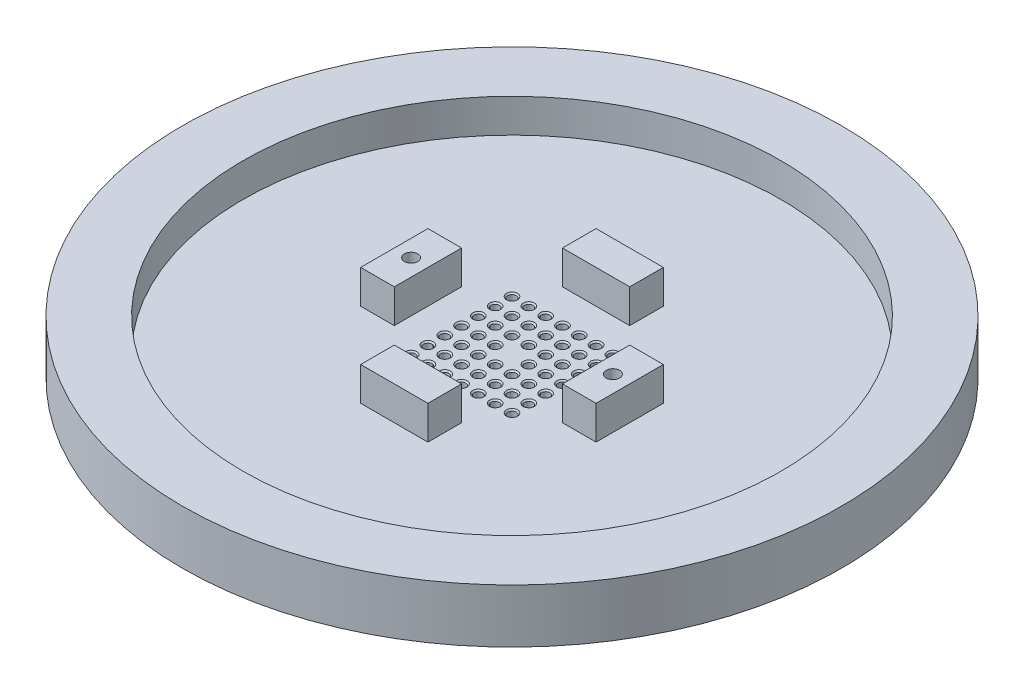
from build123d import *

# Parameters (mm, degrees)
SKETCH1_R                                     = 62.23
BILLET_DEPTH                                  = 10.16
SKETCH2_R                                     = 50.8
MANIFOLD_WELL_DEPTH                           = 6.35
SKETCH4_R                                     = 0.79375
FIRST_KEROSENE_OUTLET_DEPTH                   = 89.591034535
OUTLET_CHAMFER_SIZE                           = 0.254
KEROSENE_OUTLET_PATTERN_COUNT                 = 7
KEROSENE_OUTLET_PATTERN_PITCH                 = 3.175
KEROSENE_OUTLET_PATTERN_COUNT_DIR2            = 7
KEROSENE_OUTLET_PATTERN_PITCH_DIR2            = 3.175
OUTLET_CHAMFER_OF_KEROSENE_OUTLET_PATTER_SIZE = 0.254
LOX_PLATE_STANDOFF_REACH                      = 90.591
SKETCH5_W                                     = 12.7
SKETCH5_H                                     = 6.35
STANDOFF_PATTERN_COUNT                        = 4
SKETCH7_R                                     = 59.69
SKETCH7_R_2                                   = 57.15
O_RING_GROOVE_DEPTH                           = 2.032
SKETCH8_R                                     = 1.27
DOWEL_HOLE_1_DEPTH                            = 2.54
DOWEL_HOLE_2_COUNT                            = 2
DOWEL_HOLE_2_PITCH                            = 38.1


with BuildPart() as part:
    # Sketch1 → Billet (new body)
    with BuildSketch(Plane(origin=(0, 0, 0), x_dir=(1, 0, 0), z_dir=(0, 1, 0))):
        Circle(SKETCH1_R)
    extrude(amount=-BILLET_DEPTH)

    # Sketch2 → Manifold Well (cut)
    with BuildSketch(Plane(origin=(0, 0, 0), x_dir=(1, 0, 0), z_dir=(0, 1, 0))):
        Circle(SKETCH2_R)
    extrude(amount=-MANIFOLD_WELL_DEPTH, mode=Mode.SUBTRACT)

    # Sketch4 → First Kerosene Outlet (cut, symmetric)
    with BuildSketch(Plane(origin=(0, 0, 0), x_dir=(1, 0, 0), z_dir=(0, 1, 0))):
        with Locations((9.525, 9.525)):
            Circle(SKETCH4_R)
    first_kerosene_outlet = extrude(amount=FIRST_KEROSENE_OUTLET_DEPTH, both=True, mode=Mode.SUBTRACT)

    # Outlet Chamfer
    outlet_chamfer_edges = [part.edges().sort_by_distance(p)[0] for p in [
        (8.73125, -6.35, -9.525),
    ]]
    chamfer(outlet_chamfer_edges, length=OUTLET_CHAMFER_SIZE)

    # Kerosene Outlet Pattern: First Kerosene Outlet 7 × 7, 1 skipped
    with Locations(*[(-j * KEROSENE_OUTLET_PATTERN_PITCH_DIR2, 0, i * KEROSENE_OUTLET_PATTERN_PITCH) for i in range(KEROSENE_OUTLET_PATTERN_COUNT) for j in range(KEROSENE_OUTLET_PATTERN_COUNT_DIR2) if (i, j) not in ((0, 0), (3, 3))]):
        add(first_kerosene_outlet, mode=Mode.SUBTRACT)

    # Outlet Chamfer of Kerosene Outlet Patter
    outlet_chamfer_of_kerosene_outlet_patter_edges = [part.edges().sort_by_distance(p)[0] for p in [
        (5.55625, -6.35, -9.525),
        (2.38125, -6.35, -9.525),
        (-0.79375, -6.35, -9.525),
        (-3.96875, -6.35, -9.525),
        (-7.14375, -6.35, -9.525),
        (-10.31875, -6.35, -9.525),
        (8.73125, -6.35, -6.35),
        (5.55625, -6.35, -6.35),
        (2.38125, -6.35, -6.35),
        (-0.79375, -6.35, -6.35),
        (-3.96875, -6.35, -6.35),
        (-7.14375, -6.35, -6.35),
        (-10.31875, -6.35, -6.35),
        (8.73125, -6.35, -3.175),
        (5.55625, -6.35, -3.175),
        (2.38125, -6.35, -3.175),
        (-0.79375, -6.35, -3.175),
        (-3.96875, -6.35, -3.175),
        (-7.14375, -6.35, -3.175),
        (-10.31875, -6.35, -3.175),
        (8.73125, -6.35, 0),
        (5.55625, -6.35, 0),
        (2.38125, -6.35, 0),
        (-3.96875, -6.35, 0),
        (-7.14375, -6.35, 0),
        (-10.31875, -6.35, 0),
        (8.73125, -6.35, 3.175),
        (5.55625, -6.35, 3.175),
        (2.38125, -6.35, 3.175),
        (-0.79375, -6.35, 3.175),
        (-3.96875, -6.35, 3.175),
        (-7.14375, -6.35, 3.175),
        (-10.31875, -6.35, 3.175),
        (8.73125, -6.35, 6.35),
        (5.55625, -6.35, 6.35),
        (2.38125, -6.35, 6.35),
        (-0.79375, -6.35, 6.35),
        (-3.96875, -6.35, 6.35),
        (-7.14375, -6.35, 6.35),
        (-10.31875, -6.35, 6.35),
        (8.73125, -6.35, 9.525),
        (5.55625, -6.35, 9.525),
        (2.38125, -6.35, 9.525),
        (-0.79375, -6.35, 9.525),
        (-3.96875, -6.35, 9.525),
        (-7.14375, -6.35, 9.525),
        (-10.31875, -6.35, 9.525),
    ]]
    chamfer(outlet_chamfer_of_kerosene_outlet_patter_edges, length=OUTLET_CHAMFER_OF_KEROSENE_OUTLET_PATTER_SIZE)

    # Sketch5 → LOX Plate Standoff (add, up to next)
    with BuildSketch(Plane(origin=(0, 0, 0), x_dir=(1, 0, 0), z_dir=(0, 1, 0)), mode=Mode.PRIVATE) as lox_plate_standoff_sk1:
        with Locations((0, 19.05)):
            Rectangle(SKETCH5_W, SKETCH5_H)
    lox_plate_standoff_tool1 = extrude(lox_plate_standoff_sk1.sketch, amount=-LOX_PLATE_STANDOFF_REACH, mode=Mode.PRIVATE) - part.part
    lox_plate_standoff = lox_plate_standoff_tool1.solids().sort_by_distance((0, 0, -19.05))[0]
    add(lox_plate_standoff)

    # Standoff Pattern: LOX Plate Standoff ×4 about axis
    standoff_pattern_axis = Axis((0, 0.508, 0), (0, -1, 0))
    for i in range(1, STANDOFF_PATTERN_COUNT):
        add(lox_plate_standoff.rotate(standoff_pattern_axis, i * 360 / STANDOFF_PATTERN_COUNT))

    # Sketch7 → O-Ring Groove (cut)
    with BuildSketch(Plane.XZ.offset(10.16)):
        Circle(SKETCH7_R)
        Circle(SKETCH7_R_2, mode=Mode.SUBTRACT)
    extrude(amount=-O_RING_GROOVE_DEPTH, mode=Mode.SUBTRACT)

    # Sketch8 → Dowel Hole 1 (cut)
    with BuildSketch(Plane(origin=(0, 0, 0), x_dir=(1, 0, 0), z_dir=(0, 1, 0))):
        with Locations((-19.05, 0)):
            Circle(SKETCH8_R)
    dowel_hole_1 = extrude(amount=-DOWEL_HOLE_1_DEPTH, mode=Mode.SUBTRACT)

    # Dowel Hole 2: Dowel Hole 1 ×2
    with Locations(*[(i * DOWEL_HOLE_2_PITCH, 0, 0) for i in range(1, DOWEL_HOLE_2_COUNT)]):
        add(dowel_hole_1, mode=Mode.SUBTRACT)


solid = part.part
